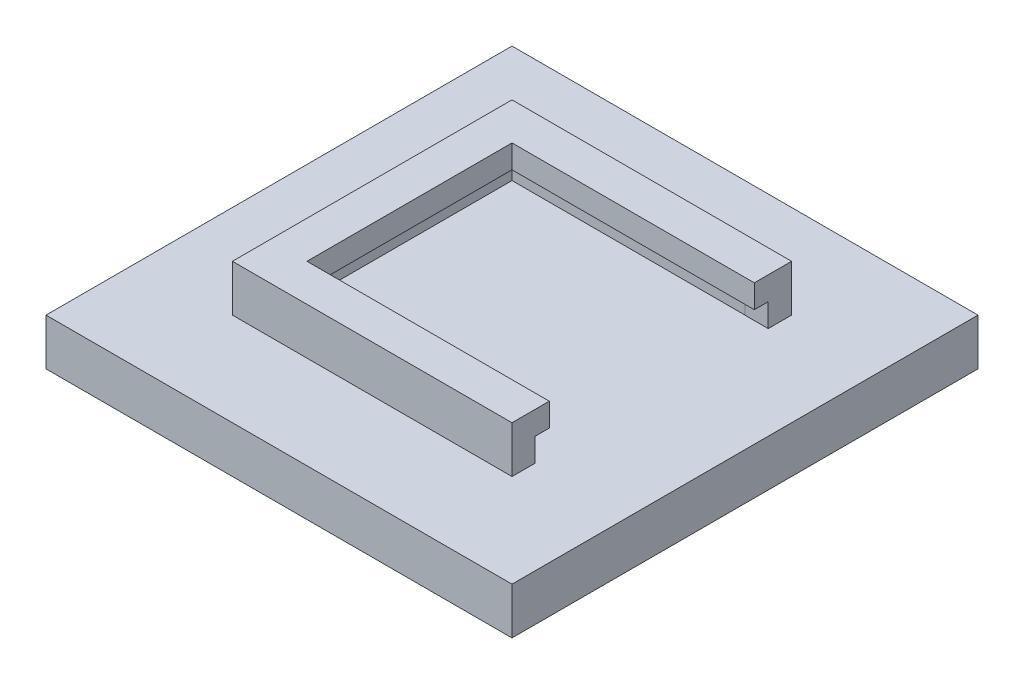
from build123d import *

# Parameters (mm, degrees)
SKETCH1_W           = 100
SKETCH1_H           = 100
BOSS_EXTRUDE1_DEPTH = 10
SKETCH2_W           = 60
SKETCH2_H           = 60
SKETCH2_W_2         = 50
SKETCH2_H_2         = 50
EXTRUDE_THIN1_DEPTH = 15
SKETCH3_W           = 5
SKETCH3_H           = 50
CUT_EXTRUDE1_DEPTH  = 5
SKETCH4_W           = 60
SKETCH4_H           = 60
BOSS_EXTRUDE2_DEPTH = 5
SKETCH5_W           = 52
SKETCH5_H           = 44
CUT_EXTRUDE2_DEPTH  = 5


with BuildPart() as part:
    # Sketch1 → Boss-Extrude1 (new body)
    with BuildSketch(Plane(origin=(0, 0, 0), x_dir=(1, 0, 0), z_dir=(0, 1, 0))):
        Rectangle(SKETCH1_W, SKETCH1_H)
    extrude(amount=BOSS_EXTRUDE1_DEPTH)

    # Sketch2 → Extrude-Thin1 (add)
    with BuildSketch(Plane(origin=(0, 0, 0), x_dir=(1, 0, 0), z_dir=(0, 1, 0))):
        Rectangle(SKETCH2_W, SKETCH2_H)
        Rectangle(SKETCH2_W_2, SKETCH2_H_2, mode=Mode.SUBTRACT)
    extrude(amount=EXTRUDE_THIN1_DEPTH)

    # Sketch3 → Cut-Extrude1 (cut)
    with BuildSketch(Plane(origin=(0, 15, 0), x_dir=(1, 0, 0), z_dir=(0, 1, 0))):
        with Locations((27.5, -0.025608499)):
            Rectangle(SKETCH3_W, SKETCH3_H)
    extrude(amount=-CUT_EXTRUDE1_DEPTH, mode=Mode.SUBTRACT)

    # Sketch4 → Boss-Extrude2 (add)
    with BuildSketch(Plane(origin=(0, 15, 0), x_dir=(1, 0, 0), z_dir=(0, 1, 0))):
        Rectangle(SKETCH4_W, SKETCH4_H)
    extrude(amount=BOSS_EXTRUDE2_DEPTH)

    # Sketch5 → Cut-Extrude2 (cut)
    with BuildSketch(Plane(origin=(0, 20, 0), x_dir=(1, 0, 0), z_dir=(0, 1, 0))):
        with Locations((4, 0)):
            Rectangle(SKETCH5_W, SKETCH5_H)
    extrude(amount=-CUT_EXTRUDE2_DEPTH, mode=Mode.SUBTRACT)


solid = part.part
